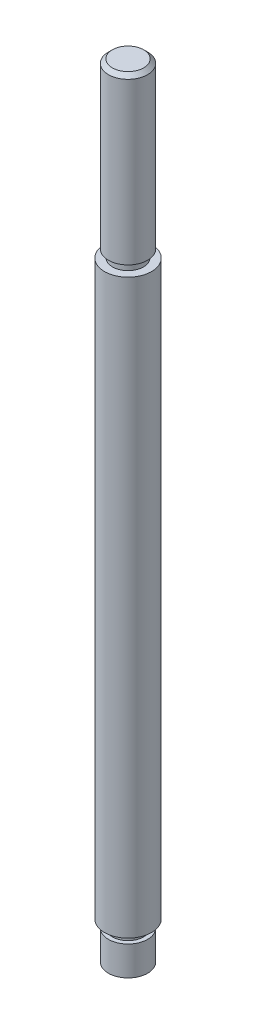
from build123d import *

# Parameters (mm, degrees)
CHAMFER1_SIZE = 1


with BuildPart() as part:
    # Sketch1 → Revolve1 (revolve)
    with BuildSketch(Plane.XY):
        Polygon((0, 0), (5, 0), (5, 7.5), (3.95, 7.5), (3.95, 9.5), (6, 9.5), (6, 155.5), (3.95, 155.5), (3.95, 157.5), (5, 157.5), (5, 199.5), (0, 199.5), align=None)
    revolve(axis=Axis((0, 0, 0), (0, 1, 0)))

    # Chamfer1
    chamfer1_edges = [part.edges().sort_by_distance(p)[0] for p in [
        (-5, 199.5, 0),
    ]]
    chamfer(chamfer1_edges, length=CHAMFER1_SIZE)


solid = part.part
